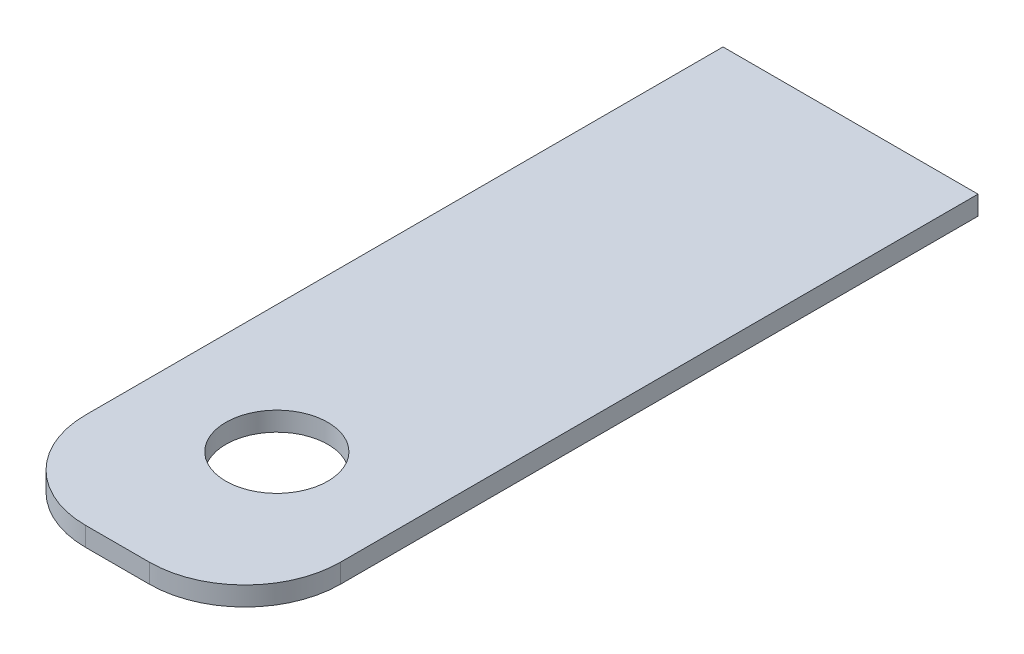
from build123d import *

# Parameters (mm, degrees)
SKETCH1_W                  = 80
SKETCH1_H                  = 230
BOSS_EXTRUDE1_DEPTH        = 6
F_32_0_32_DIAMETER_HOLE1_D = 32
FILLET1_R                  = 30


with BuildPart() as part:
    # Sketch1 → Boss-Extrude1 (new body)
    with BuildSketch(Plane(origin=(0, 0, 0), x_dir=(1, 0, 0), z_dir=(0, 1, 0))):
        with Locations((40, -115)):
            Rectangle(SKETCH1_W, SKETCH1_H)
    extrude(amount=BOSS_EXTRUDE1_DEPTH)

    # Ø32.0 (32) Diameter Hole1 (through all)
    with Locations(Plane(origin=(0, 6, 0), x_dir=(1, 0, 0), z_dir=(0, 1, 0))):
        with Locations((40, -180)):
            Hole(F_32_0_32_DIAMETER_HOLE1_D / 2)

    # Fillet1
    fillet1_edges = [part.edges().sort_by_distance(p)[0] for p in [
        (0, 3, 230),
        (80, 3, 230),
    ]]
    fillet(fillet1_edges, radius=FILLET1_R)


solid = part.part
